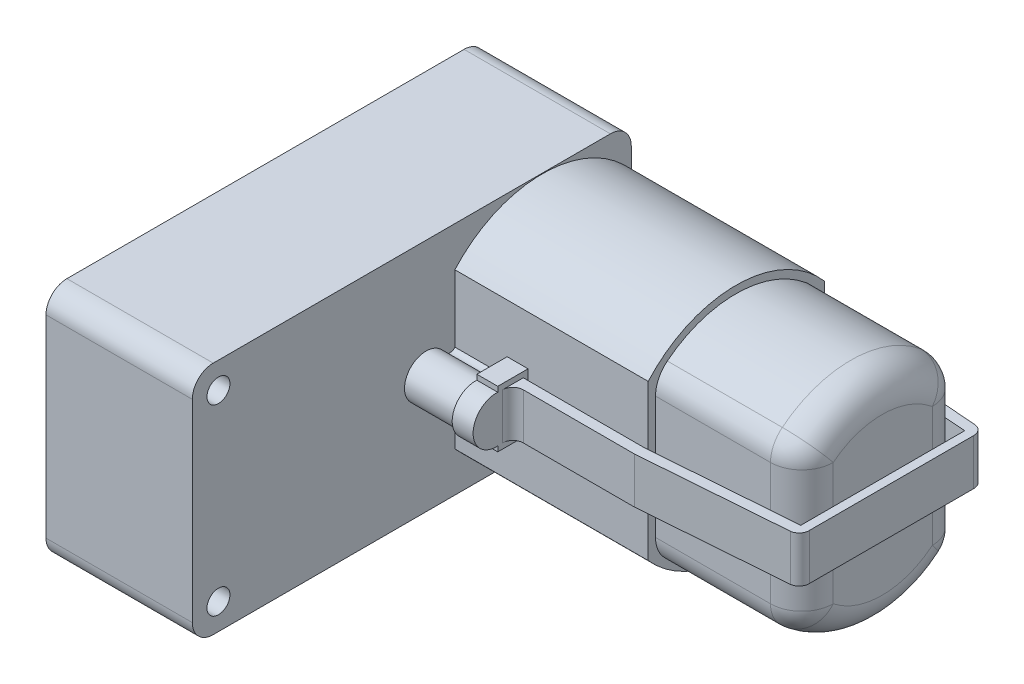
from build123d import *
from build123d.topology import SkipClean

# Parameters (mm, degrees)
SKETCH1_W            = 14
SKETCH1_H            = 42
BOSS_EXTRUDE1_DEPTH  = 22.5
FILLET1_R            = 2
BOSS_EXTRUDE2_DEPTH  = 18.5
BOSS_EXTRUDE3_DEPTH  = 5
SKETCH4_R            = 1.1
CUT_EXTRUDE1_DEPTH   = 15
SKETCH5_W            = 2
SKETCH5_H            = 4
BOSS_EXTRUDE4_DEPTH  = 5
BOSS_EXTRUDE5_DEPTH  = 4
CUT_EXTRUDE2_START   = -2
CUT_EXTRUDE2_DEPTH   = 2
SKETCH12_R           = 3.5
SKETCH12_R_2         = 3.070336519
BOSS_EXTRUDE6_DEPTH  = 1
SKETCH14_R           = 3
BOSS_EXTRUDE7_DEPTH  = 1
SKETCH15_R           = 1
BOSS_EXTRUDE8_DEPTH  = 7
SKETCH16_R           = 2
BOSS_EXTRUDE9_DEPTH  = 1.5
CUT_EXTRUDE3_DEPTH   = 18.5
BOSS_EXTRUDE10_START = 32.5
BOSS_EXTRUDE10_DEPTH = 32.5
FILLET2_R            = 3
FILLET3_R            = 3
BOSS_EXTRUDE11_DEPTH = 2
BOSS_EXTRUDE12_DEPTH = 2.2
FILLET4_R            = 1


with BuildPart() as part:
    # Sketch1 → Boss-Extrude1 (new body)
    with BuildSketch(Plane(origin=(0, 0, 0), x_dir=(1, 0, 0), z_dir=(0, 1, 0))):
        with Locations((-14.72963025, -0.456790856)):
            Rectangle(SKETCH1_W, SKETCH1_H)
    extrude(amount=BOSS_EXTRUDE1_DEPTH)

    # Fillet1
    fillet1_edges = [part.edges().sort_by_distance(p)[0] for p in [
        (-14.72963025, 22.5, -20.543209144),
        (-14.72963025, 0, -20.543209144),
        (-14.72963025, 0, 21.456790856),
        (-14.72963025, 22.5, 21.456790856),
    ]]
    fillet(fillet1_edges, radius=FILLET1_R)

    # Sketch2 → Boss-Extrude2 (add)
    with BuildSketch(Plane(origin=(-7.72963025, 0, 0), x_dir=(0, 0, -1), z_dir=(1, 0, 0))):
        with BuildLine():
            Line((3.666133326, 18.67433994), (3.666133326, 3.82566006))
            ThreePointArc((3.666133326, 3.82566006), (12.136760187, 0.056811401), (20.543209144, 3.966716207))
            Line((20.543209144, 3.966716207), (20.543209144, 18.533283793))
            ThreePointArc((20.543209144, 18.533283793), (12.136760187, 22.443188599), (3.666133326, 18.67433994))
        make_face()
    extrude(amount=BOSS_EXTRUDE2_DEPTH)

    # Sketch3 → Boss-Extrude3 (add)
    with BuildSketch(Plane(origin=(-7.72963025, 0, 0), x_dir=(0, 0, -1), z_dir=(1, 0, 0))):
        with BuildLine():
            Line((3.666133326, 12.265446457), (3.666133326, 10.341158941))
            ThreePointArc((3.666133326, 10.341158941), (3.170141933, 10.546427574), (2.72390333, 10.248075799))
            ThreePointArc((2.72390333, 10.248075799), (-1.152649836, 11.204898318), (2.678489822, 12.329861741))
            ThreePointArc((2.678489822, 12.329861741), (3.155102255, 12.033793242), (3.666133326, 12.265446457))
        make_face()
    extrude(amount=BOSS_EXTRUDE3_DEPTH)

    # Sketch4 → Cut-Extrude1 (cut)
    with BuildSketch(Plane(origin=(-7.72963025, 0, 0), x_dir=(0, 0, -1), z_dir=(1, 0, 0))):
        with Locations((-18.956790856, 20)):
            Circle(SKETCH4_R)
        with Locations((-18.956790856, 2.5)):
            Circle(SKETCH4_R)
    extrude(amount=-CUT_EXTRUDE1_DEPTH, mode=Mode.SUBTRACT)

    # Sketch5 → Boss-Extrude4 (add)
    with BuildSketch(Plane(origin=(0, 0, -20.543209144), x_dir=(-1, 0, 0), z_dir=(0, 0, -1))):
        with Locations((7.72963025, 11.25)):
            Rectangle(SKETCH5_W, SKETCH5_H)
    extrude(amount=BOSS_EXTRUDE4_DEPTH)

    # Sketch6 → Boss-Extrude5 (add)
    with BuildSketch(Plane(origin=(-6.72963025, 0, 0), x_dir=(0, 0, -1), z_dir=(1, 0, 0))):
        with BuildLine():
            ThreePointArc((21.679339079, 11.975250565), (21.032871281, 11.616126027), (20.543209144, 12.17031195))
            Line((20.543209144, 12.17031195), (20.543209144, 10.774749435))
            ThreePointArc((20.543209144, 10.774749435), (21.198638933, 11.046780591), (21.679339079, 10.524749435))
            ThreePointArc((21.679339079, 10.524749435), (25.543209144, 11.25), (21.679339079, 11.975250565))
        make_face()
    extrude(amount=BOSS_EXTRUDE5_DEPTH)

    # Sketch7 → Cut-Extrude2 (cut)
    with BuildSketch(Plane(origin=(-6.72963025, 0, 0), x_dir=(0, 0, -1), z_dir=(1, 0, 0)).offset(CUT_EXTRUDE2_START)):
        with BuildLine():
            Line((23.543209144, 13.25), (23.543209144, 13.967200788))
            Line((23.543209144, 13.967200788), (25.760178749, 13.967200788))
            Line((25.760178749, 13.967200788), (25.760178749, 8.970470958))
            Line((25.760178749, 8.970470958), (23.543209144, 8.970470958))
            Line((23.543209144, 8.970470958), (23.543209144, 9.25))
            ThreePointArc((23.543209144, 9.25), (25.543209144, 11.25), (23.543209144, 13.25))
        make_face()
    extrude(amount=CUT_EXTRUDE2_DEPTH, mode=Mode.SUBTRACT)

    # Sketch12 → Boss-Extrude6 (add)
    with BuildSketch(Plane.ZY.offset(21.72963025)):
        with Locations(Location((10.456790856, 11.25, 0), (0, 0, 180))):
            Circle(SKETCH12_R)
        with Locations((10.456790856, 11.25)):
            Circle(SKETCH12_R_2, mode=Mode.SUBTRACT)
    extrude(amount=BOSS_EXTRUDE6_DEPTH)

    # Sketch14 → Boss-Extrude7 (add)
    with BuildSketch(Plane.ZY.offset(21.72963025)):
        with Locations(Location((10.456790856, 11.25, 0), (0, 0, 180))):
            Circle(SKETCH14_R)
    extrude(amount=BOSS_EXTRUDE7_DEPTH)

    # Sketch15 → Boss-Extrude8 (add)
    with SkipClean():  # the faces are left unmerged after this step: merging them gives an invalid solid
        with BuildSketch(Plane.ZY.offset(22.72963025)):
            with BuildLine():
                Line((8.853884636, 8.714119157), (8.853884636, 13.785880843))
                ThreePointArc((8.853884636, 13.785880843), (10.456790856, 14.25), (12.059697077, 13.785880843))
                Line((12.059697077, 13.785880843), (12.059697077, 8.714119157))
                ThreePointArc((12.059697077, 8.714119157), (10.456790856, 8.25), (8.853884636, 8.714119157))
            make_face()
            with Locations((10.456790856, 11.25)):
                Circle(SKETCH15_R, mode=Mode.SUBTRACT)
        extrude(amount=BOSS_EXTRUDE8_DEPTH)

    # Sketch16 → Boss-Extrude9 (add)
    with SkipClean():  # the faces are left unmerged after this step: merging them gives an invalid solid
        with BuildSketch(Plane.ZY.offset(21.72963025)):
            with Locations(Location((-0.543209144, 11.25, 0), (0, 0, 180))):
                Circle(SKETCH16_R)
        extrude(amount=BOSS_EXTRUDE9_DEPTH)

    # Sketch17 → Cut-Extrude3 (cut)
    with SkipClean():  # the faces are left unmerged after this step: merging them gives an invalid solid
        with BuildSketch(Plane(origin=(10.77036975, 0, 0), x_dir=(0, 0, -1), z_dir=(1, 0, 0))):
            with BuildLine():
                Line((19.843209144, 4.230369564), (19.843209144, 18.269630436))
                ThreePointArc((19.843209144, 18.269630436), (12.134214683, 21.743184905), (4.366133326, 18.403860381))
                Line((4.366133326, 18.403860381), (4.366133326, 4.096139619))
                ThreePointArc((4.366133326, 4.096139619), (12.134214683, 0.756815095), (19.843209144, 4.230369564))
            make_face()
        extrude(amount=-CUT_EXTRUDE3_DEPTH, mode=Mode.SUBTRACT)

    # Sketch18 → Boss-Extrude10 (add)
    with SkipClean():  # the faces are left unmerged after this step: merging them gives an invalid solid
        with BuildSketch(Plane(origin=(-7.72963025, 0, 0), x_dir=(0, 0, -1), z_dir=(1, 0, 0)).offset(BOSS_EXTRUDE10_START)):
            with BuildLine():
                Line((19.843209144, 4.230369564), (19.843209144, 18.269630436))
                ThreePointArc((19.843209144, 18.269630436), (12.134214683, 21.743184905), (4.366133326, 18.403860381))
                Line((4.366133326, 18.403860381), (4.366133326, 4.096139619))
                ThreePointArc((4.366133326, 4.096139619), (12.134214683, 0.756815095), (19.843209144, 4.230369564))
            make_face()
        extrude(amount=-BOSS_EXTRUDE10_DEPTH)

    # Fillet2
    # the kernel refuses this fillet: 3 mm, written as the material it takes off along each edge
    with BuildSketch(Plane(origin=(24.77036975, 11.25, -12.043209144), x_dir=(0, -0.03508404520009265, 0.9993843653832083), z_dir=(0, 0.9993843653832083, 0.03508404520009265))) as fillet2_piece_1:
        with BuildLine():
            CenterArc((10.493579535 - FILLET2_R, -FILLET2_R), FILLET2_R, 0, 90)
            Line((10.493579535 - FILLET2_R, 0), (10.493579535, 0))
            Line((10.493579535, 0), (10.493579535, -FILLET2_R))
        make_face()
    revolve(axis=Axis((24.77036975, 11.25, -12.043209144), (1, 0, 0)), revolution_arc=176.972646772, mode=Mode.SUBTRACT)
    with BuildSketch(Plane(origin=(24.77036975, -3.269630436, -19.843209144), x_dir=(-1, 0, 0), z_dir=(0, 1, 0))) as fillet2_piece_2:
        with BuildLine():
            CenterArc((FILLET2_R, FILLET2_R), FILLET2_R, 180, 90)
            Line((0, FILLET2_R), (0, 0))
            Line((0, 0), (FILLET2_R, 0))
        make_face()
    extrude(amount=29.039260873, mode=Mode.SUBTRACT)
    with BuildSketch(Plane(origin=(24.77036975, 11.25, -12.043209144), x_dir=(0, 0.017745103398297987, -0.9998425432563788), z_dir=(0, -0.9998425432563788, -0.017745103398297987))) as fillet2_piece_3:
        with BuildLine():
            CenterArc((10.493579535 - FILLET2_R, -FILLET2_R), FILLET2_R, 0, 90)
            Line((10.493579535 - FILLET2_R, 0), (10.493579535, 0))
            Line((10.493579535, 0), (10.493579535, -FILLET2_R))
        make_face()
    revolve(axis=Axis((24.77036975, 11.25, -12.043209144), (1, 0, 0)), revolution_arc=176.972646772, mode=Mode.SUBTRACT)
    with BuildSketch(Plane(origin=(24.77036975, 25.903860381, -4.366133326), x_dir=(-1, 0, 0), z_dir=(0, -1, 0))) as fillet2_piece_4:
        with BuildLine():
            CenterArc((FILLET2_R, FILLET2_R), FILLET2_R, 180, 90)
            Line((0, FILLET2_R), (0, 0))
            Line((0, 0), (FILLET2_R, 0))
        make_face()
    extrude(amount=29.307720762, mode=Mode.SUBTRACT)

    # Fillet3
    fillet3_edges = [part.edges().sort_by_distance(p)[0] for p in [
        (16.27036975, 4.096139619, -4.366133326),
        (16.27036975, 18.403860381, -4.366133326),
        (16.27036975, 18.269630436, -19.843209144),
        (16.27036975, 4.230369564, -19.843209144),
        (23.939626378, 17.904127425, -18.915484598),
        (23.939626378, 4.595872575, -18.915484598),
        (23.942018914, 18.027736711, -5.296365269),
        (23.942018914, 4.472263289, -5.296365269),
    ]]
    fillet(fillet3_edges, radius=FILLET3_R)

    # Sketch19 → Boss-Extrude11 (add)
    with BuildSketch(Plane(origin=(-2.72963025, 0, 0), x_dir=(0, 0, -1), z_dir=(1, 0, 0))):
        with BuildLine():
            Line((0.768030026, 13.473431353), (0.768030026, 13.968221025))
            Line((0.768030026, 13.968221025), (3.666133326, 13.968221025))
            Line((3.666133326, 13.968221025), (3.666133326, 8.531778975))
            Line((3.666133326, 8.531778975), (0.768030026, 8.531778975))
            Line((0.768030026, 8.531778975), (0.768030026, 9.026568647))
            ThreePointArc((0.768030026, 9.026568647), (-1.590616444, 11.25), (0.768030026, 13.473431353))
        make_face()
        with BuildLine():
            Line((23.505490349, 8.531778975), (23.505490349, 9.026568647))
            ThreePointArc((23.505490349, 9.026568647), (25.864136819, 11.25), (23.505490349, 13.473431353))
            Line((23.505490349, 13.473431353), (23.505490349, 13.968221025))
            Line((23.505490349, 13.968221025), (20.607387049, 13.968221025))
            Line((20.607387049, 13.968221025), (20.607387049, 8.531778975))
            Line((20.607387049, 8.531778975), (23.505490349, 8.531778975))
        make_face()
    extrude(amount=BOSS_EXTRUDE11_DEPTH)

    # Sketch22 → Boss-Extrude12 (add, symmetric)
    with BuildSketch(Plane(origin=(0, 11.25, 0), x_dir=(-1, 0, 0), z_dir=(0, -1, 0))):
        with BuildLine():
            Line((0.72963025, 3.208547986), (0.72963025, 2.217081676))
            Line((0.72963025, 2.217081676), (-10.91025311, 2.217081676))
            Line((-10.91025311, 2.217081676), (-24.765511007, 3.274279543))
            ThreePointArc((-24.765511007, 3.274279543), (-25.380466801, 3.60490992), (-25.6047274, 4.26611659))
            Line((-25.6047274, 4.26611659), (-25.6047274, 19.94322588))
            ThreePointArc((-25.6047274, 19.94322588), (-25.380466801, 20.604432549), (-24.765511007, 20.935062926))
            Line((-24.765511007, 20.935062926), (-10.91025311, 21.992260794))
            Line((-10.91025311, 21.992260794), (0.72963025, 21.992260794))
            Line((0.72963025, 21.992260794), (0.72963025, 21.000794484))
            Line((0.72963025, 21.000794484), (-10.91025311, 21.000794484))
            Line((-10.91025311, 21.000794484), (-24.77036975, 19.94322588))
            Line((-24.77036975, 19.94322588), (-24.77036975, 4.26611659))
            Line((-24.77036975, 4.26611659), (-10.91025311, 3.208547986))
            Line((-10.91025311, 3.208547986), (0.72963025, 3.208547986))
        make_face()
    extrude(amount=BOSS_EXTRUDE12_DEPTH, both=True)

    # Fillet4
    fillet4_edges = [part.edges().sort_by_distance(p)[0] for p in [
        (-0.72963025, 11.25, -21.992260794),
        (-0.72963025, 11.25, -2.217081676),
    ]]
    fillet(fillet4_edges, radius=FILLET4_R)


solid = part.part
